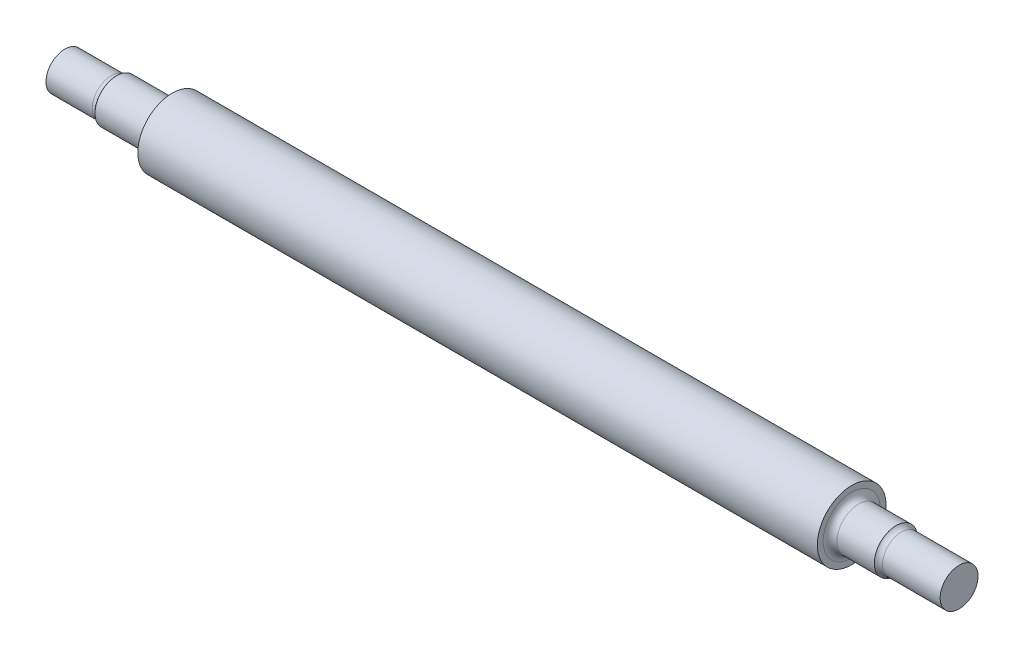
from build123d import *

# Parameters (mm, degrees)
FILLET1_R = 1.27


with BuildPart() as part:
    # Sketch1 → Revolve-Thin1 (revolve)
    with BuildSketch(Plane(origin=(0, 0, 0), x_dir=(1, 0, 0), z_dir=(0, 1, 0)), mode=Mode.PRIVATE) as revolve_thin1_sk:
        Polygon((-77.419354839, 0), (-77.419354839, 3.5), (-67.870967742, 3.5), (-67.870967742, 4), (-57.608712258, 4), (-57.608712258, 6.35), (67.904423226, 6.35), (67.904423226, 4), (76.082332903, 4), (76.082332903, 3.5), (87.741935484, 3.5), (87.741935484, 0), (85.201935484, 0), (85.201935484, 0.96), (73.542332903, 0.96), (73.542332903, 1.46), (65.364423226, 1.46), (65.364423226, 3.81), (-55.068712258, 3.81), (-55.068712258, 1.46), (-65.330967742, 1.46), (-65.330967742, 0.96), (-74.879354839, 0.96), (-74.879354839, 0), align=None)
    revolve(revolve_thin1_sk.sketch.rotate(Axis((-77.419354839, 0, 0), (1, 0, 0)), 180), axis=Axis((-77.419354839, 0, 0), (1, 0, 0)))

    # Fillet1
    # the kernel refuses this fillet: 1.27 mm, written as the material it adds along each edge
    with BuildSketch(Plane(origin=(-67.870967742, 0, 0), x_dir=(0, 0, 1), z_dir=(0, 1, 0))) as fillet1_piece_1:
        with BuildLine():
            CenterArc((4.77, -1.009950494), FILLET1_R, 127.322390296, 52.677609704)
            Line((4, 0), (3.9846, 0.02019901))
            ThreePointArc((3.9846, 0.02019901), (3.75, 0.0254), (3.5, 0.0254))
            Line((3.5, 0.0254), (3.4746, 0))
            Line((3.4746, 0), (3.4746, -1.009950494))
            Line((3.4746, -1.009950494), (3.5, -1.009950494))
        make_face()
    revolve(axis=Axis((-67.870967742, 0, 0), (1, 0, 0)))
    with BuildSketch(Plane(origin=(-57.608712258, 0, 0), x_dir=(0, 0, 1), z_dir=(0, 1, 0))) as fillet1_piece_2:
        with BuildLine():
            CenterArc((4 + FILLET1_R, -FILLET1_R), FILLET1_R, 90, 90)
            Line((4 + FILLET1_R, 0), (4 + FILLET1_R, FILLET1_R * 0.02))
            Line((4 + FILLET1_R, FILLET1_R * 0.02), (4 - FILLET1_R * 0.02, FILLET1_R * 0.02))
            Line((4 - FILLET1_R * 0.02, FILLET1_R * 0.02), (4 - FILLET1_R * 0.02, -FILLET1_R))
            Line((4 - FILLET1_R * 0.02, -FILLET1_R), (4, -FILLET1_R))
        make_face()
    revolve(axis=Axis((-57.608712258, 0, 0), (1, 0, 0)))
    with BuildSketch(Plane(origin=(67.904423226, 0, 0), x_dir=(0, 0, 1), z_dir=(0, 1, 0))) as fillet1_piece_3:
        with BuildLine():
            CenterArc((4 + FILLET1_R, FILLET1_R), FILLET1_R, 180, 90)
            Line((4, FILLET1_R), (4 - FILLET1_R * 0.02, FILLET1_R))
            Line((4 - FILLET1_R * 0.02, FILLET1_R), (4 - FILLET1_R * 0.02, -FILLET1_R * 0.02))
            Line((4 - FILLET1_R * 0.02, -FILLET1_R * 0.02), (4 + FILLET1_R, -FILLET1_R * 0.02))
            Line((4 + FILLET1_R, -FILLET1_R * 0.02), (4 + FILLET1_R, 0))
        make_face()
    revolve(axis=Axis((67.904423226, 0, 0), (1, 0, 0)))
    with BuildSketch(Plane(origin=(76.082332903, 0, 0), x_dir=(0, 0, 1), z_dir=(0, 1, 0))) as fillet1_piece_4:
        with BuildLine():
            CenterArc((4.77, 1.009950494), FILLET1_R, 180, 52.677609704)
            Line((3.5, 1.009950494), (3.4746, 1.009950494))
            Line((3.4746, 1.009950494), (3.4746, 0))
            Line((3.4746, 0), (3.5, -0.0254))
            ThreePointArc((3.5, -0.0254), (3.75, -0.0254), (3.9846, -0.02019901))
            Line((3.9846, -0.02019901), (4, 0))
        make_face()
    revolve(axis=Axis((76.082332903, 0, 0), (1, 0, 0)))


solid = part.part
